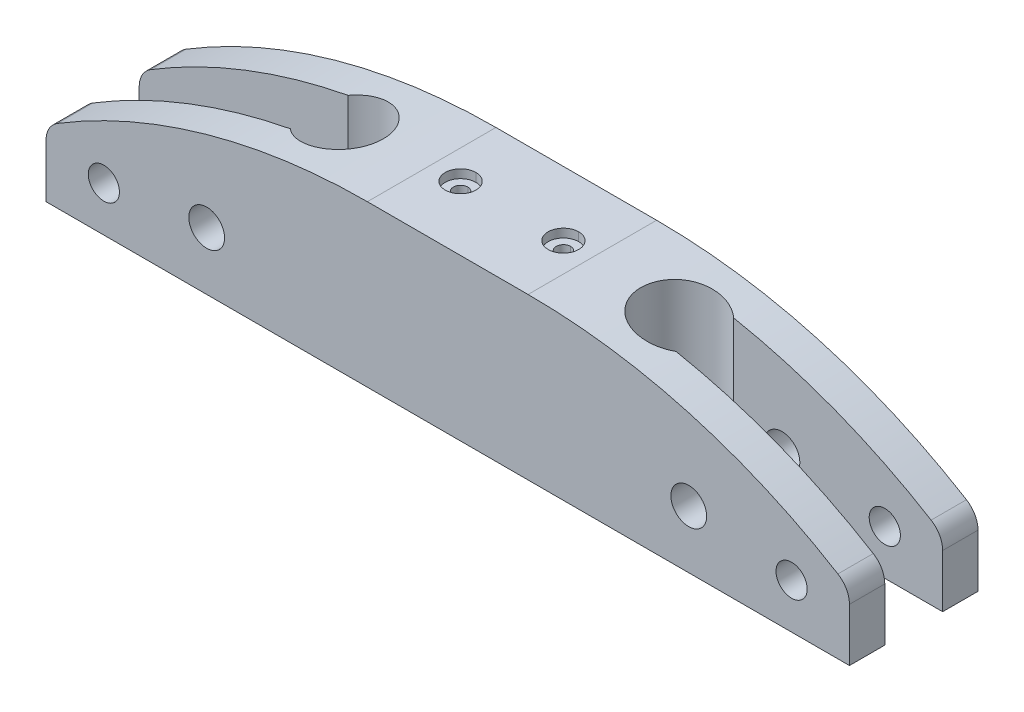
from build123d import *
from build123d.topology import SkipClean

# Parameters (mm, degrees)
BOSS_EXTRUDE1_DEPTH                           = 20
CUT_EXTRUDE1_REACH                            = 138.107
CBORE_START                                   = -20
CBORE_SLOT_FOR_8_BINDING_HEAD_MACHINE_S_DEPTH = 20
CBORE_START_2                                 = -2.667
CBORE_SLOT_FOR_8_BINDING_HEAD_MACHI_3_DEPTH   = 2.667
CBORE_START_3                                 = -16.001499
CBORE_SLOT_FOR_8_BINDING_HEAD_MACHI_4_DEPTH   = 0.002997
CUT_EXTRUDE2_REACH                            = 142.446
SKETCH9_R                                     = 4.853907
SKETCH9_R_2                                   = 5.563946
FILLET2_R                                     = 7.5
FILLET3_R                                     = 7.5


with BuildPart() as part:
    # Sketch1 → Boss-Extrude1 (new, symmetric)
    with BuildSketch(Plane.XY):
        with BuildLine():
            Line((0, -50), (-125, -50))
            Line((-125, -50), (-125, -29.356176))
            ThreePointArc((-125, -29.356176), (-77.109944, -7.490694), (-25, 0))
            Line((-25, 0), (0, 0))
            Line((0, 0), (0, -50))
        make_face()
    extrude(amount=BOSS_EXTRUDE1_DEPTH, both=True)

    # Cut-Extrude1: up to this face of the body (flat: up to its plane)
    cut_extrude1_end = Plane(part.part.faces().sort_by_distance((-62.5, -50, 0))[0])
    # Sketch2 → Cut-Extrude1 (cut, up to the picked face)
    with BuildSketch(Plane(origin=(0, 0, 0), x_dir=(1, 0, 0), z_dir=(0, 1, 0)), mode=Mode.PRIVATE) as cut_extrude1_sk1:
        with BuildLine():
            Line((-59.997254, 9), (-125, 9))
            Line((-125, 9), (-125, -9))
            Line((-125, -9), (-59.997254, -9))
            ThreePointArc((-59.997254, -9), (-40.06, 0), (-59.997254, 9))
        make_face()
    cut_extrude1_tool1 = split(extrude(cut_extrude1_sk1.sketch, amount=-CUT_EXTRUDE1_REACH, mode=Mode.PRIVATE), bisect_by=cut_extrude1_end, keep=Keep.BOTH, mode=Mode.PRIVATE)
    add(cut_extrude1_tool1.solids().sort_by(Axis((-81.854242, 0, 0), (0, -1, 0)))[0], mode=Mode.SUBTRACT)

    # CBORE SLOT for #8 Binding Head Machine Screw2: read off the stored shape, not the designer's step
    # CBORE SLOT for _8 Binding Head Machi 2 → CBORE SLOT for #8 Binding Head Machine Screw2 (cut)
    with BuildSketch(Plane(origin=(0, 0, 0), x_dir=(1, 0, 0), z_dir=(0, 1, 0)).offset(CBORE_START)):
        with BuildLine():
            Line((-16.001499, -2.2479), (-15.998501, -2.2479))
            ThreePointArc((-15.998501, -2.2479), (-13.750601, 0), (-15.998501, 2.2479))
            Line((-15.998501, 2.2479), (-16.001499, 2.2479))
            ThreePointArc((-16.001499, 2.2479), (-18.249399, 0), (-16.001499, -2.2479))
        make_face()
    extrude(amount=CBORE_SLOT_FOR_8_BINDING_HEAD_MACHINE_S_DEPTH, mode=Mode.SUBTRACT)

    # CBORE SLOT for _8 Binding Head Machi 3 o → CBORE SLOT for _8 Binding Head Machi 3 (cut)
    with BuildSketch(Plane(origin=(0, 0, 0), x_dir=(1, 0, 0), z_dir=(0, 1, 0)).offset(CBORE_START_2)):
        with BuildLine():
            Line((-16.001499, -4.7625), (-15.998501, -4.7625))
            ThreePointArc((-15.998501, -4.7625), (-11.236001, 0), (-15.998501, 4.7625))
            Line((-15.998501, 4.7625), (-16.001499, 4.7625))
            ThreePointArc((-16.001499, 4.7625), (-20.763999, 0), (-16.001499, -4.7625))
        make_face()
        with BuildLine():
            ThreePointArc((-15.998501, 2.2479), (-13.750601, 0), (-15.998501, -2.2479))
            Line((-15.998501, -2.2479), (-16.001499, -2.2479))
            ThreePointArc((-16.001499, -2.2479), (-18.249399, 0), (-16.001499, 2.2479))
            Line((-16.001499, 2.2479), (-15.998501, 2.2479))
        make_face(mode=Mode.SUBTRACT)
    extrude(amount=CBORE_SLOT_FOR_8_BINDING_HEAD_MACHI_3_DEPTH, mode=Mode.SUBTRACT)

    # CBORE SLOT for _8 Binding Head Machi 4 o → CBORE SLOT for _8 Binding Head Machi 4 (cut)
    with BuildSketch(Plane.YZ.offset(CBORE_START_3)):
        Polygon((-20, 2.2479), (-21.350675, 0), (-20, -2.2479), align=None)
    extrude(amount=CBORE_SLOT_FOR_8_BINDING_HEAD_MACHI_4_DEPTH, mode=Mode.SUBTRACT)

    # CBORE SLOT for _8 Binding Head Machi 5 o → CBORE SLOT for _8 Binding Head Machi 5 (revolve, cut)
    with SkipClean():  # the faces are left unmerged after this step: merging them gives an invalid solid
        with BuildSketch(Plane(origin=(-15.998501, 0, 0), x_dir=(1, 0, 0), z_dir=(0, 0, 1))):
            Polygon((0, -20), (0, -21.350675), (2.2479, -20), align=None)
        revolve(axis=Axis((-15.998501, 0, 0), (0, 1, 0)), mode=Mode.SUBTRACT)

    # CBORE SLOT for _8 Binding Head Machi 6 o → CBORE SLOT for _8 Binding Head Machi 6 (revolve, cut)
    with SkipClean():  # the faces are left unmerged after this step: merging them gives an invalid solid
        with BuildSketch(Plane(origin=(-16.001499, 0, 0), x_dir=(1, 0, 0), z_dir=(0, 0, 1))):
            Polygon((0, -20), (0, -21.350675), (2.2479, -20), align=None)
        revolve(axis=Axis((-16.001499, 0, 0), (0, 1, 0)), mode=Mode.SUBTRACT)

    # Cut-Extrude2: up to this face of the body (flat: up to its plane)
    cut_extrude2_end = Plane(part.part.faces().sort_by_distance((-55.744446, -27.909229, -20))[0])
    # Sketch9 → Cut-Extrude2 (cut, up to the picked face)
    with BuildSketch(Plane.XY.offset(20), mode=Mode.PRIVATE) as cut_extrude2_sk1:
        with Locations(Location((-107, -36, 0), (0, 0, 180))):
            Circle(SKETCH9_R)
    cut_extrude2_tool1 = split(extrude(cut_extrude2_sk1.sketch, amount=-CUT_EXTRUDE2_REACH, mode=Mode.PRIVATE), bisect_by=cut_extrude2_end, keep=Keep.BOTH, mode=Mode.PRIVATE)
    # Sketch9 → Cut-Extrude2 (cut, up to the picked face)
    with BuildSketch(Plane.XY.offset(20), mode=Mode.PRIVATE) as cut_extrude2_sk2:
        with Locations(Location((-75, -32, 0), (0, 0, 180))):
            Circle(SKETCH9_R_2)
    cut_extrude2_tool2 = split(extrude(cut_extrude2_sk2.sketch, amount=-CUT_EXTRUDE2_REACH, mode=Mode.PRIVATE), bisect_by=cut_extrude2_end, keep=Keep.BOTH, mode=Mode.PRIVATE)
    add(cut_extrude2_tool1.solids().sort_by(Axis((-107, -36, 20), (0, 0, -1)))[0], mode=Mode.SUBTRACT)
    add(cut_extrude2_tool2.solids().sort_by(Axis((-75, -32, 20), (0, 0, -1)))[0], mode=Mode.SUBTRACT)

    # Fillet2
    fillet2_edges = [part.edges().sort_by_distance(p)[0] for p in [
        (-125, -29.356176, 14.5),
    ]]
    fillet(fillet2_edges, radius=FILLET2_R)

    # Fillet3
    fillet3_edges = [part.edges().sort_by_distance(p)[0] for p in [
        (-125, -29.356176, -14.5),
    ]]
    fillet(fillet3_edges, radius=FILLET3_R)

    # Mirror2: part across plane


with BuildPart() as part_1:
    with SkipClean():  # the faces are left unmerged after this step: merging them gives an invalid solid
        add(part.part)
        add(part.part.mirror(Plane(origin=(0, 0, 20), x_dir=(0, 0, 1), z_dir=(-1, 0, 0))))


solid = part_1.part
